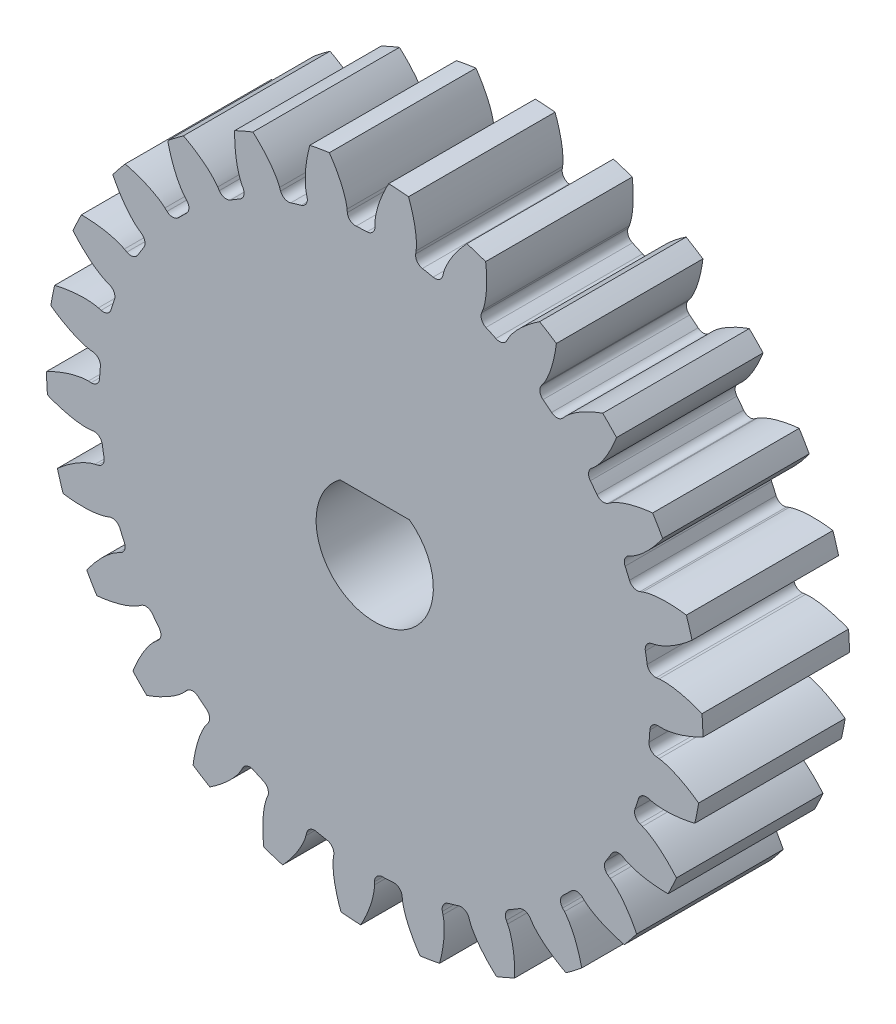
from build123d import *

# Parameters (mm, degrees)
SKETCH_1_R               = 11.2
EXTRUDE_1_DEPTH          = 5
CUT_EXTRUDE_1_DEPTH      = 17.609635758
FILLET_2_R               = 0.28
FILLET_2_OF_MIRROR_1_R   = 0.28
PATTERN_START            = -5
PATTERN_CIRCULAR_1_DEPTH = 5
SKETCH_2_R               = 2
CUT_EXTRUDE_2_DEPTH      = 17.601548526
EXTRUDE_3_DEPTH          = 5


# Read off the part's stored shape, not the designer's step: 円形ﾊﾟﾀｰﾝ1
with BuildPart() as part:
    # ｽｹｯﾁ1 → ﾎﾞｽ - 押し出し1 (new body)
    with BuildSketch(Plane.XY):
        Circle(SKETCH_1_R)
    extrude(amount=-EXTRUDE_1_DEPTH)

    # ｽｹｯﾁ1<3> → ｶｯﾄ - 押し出し1 (cut, symmetric)
    with BuildSketch(Plane.XY):
        with BuildLine():
            add(Edge.make_bspline(
                [(10.399190503, -0.129757001), (10.400093288, -0.129490448), (10.497765099, -0.100614056), (10.696224846, -0.033467992), (10.896342165, 0.049399549), (11.090355847, 0.143158919), (11.191994029, 0.195879842), (11.198229682, 0.199128068)],
                knots=[0.029784794, 0.029784794, 0.029784794, 0.029784794, 0.029784794, 0.029959921, 0.048733673, 0.068727069, 0.07003512, 0.07003512, 0.07003512, 0.07003512, 0.07003512], degree=4))
            ThreePointArc((10.399190503, -0.129757001), (10.390527177, -0.443784844), (10.372383211, -0.757407764))
            Line((10.372383211, -0.757407764), (11.170258843, -0.8156699))
            ThreePointArc((11.170258843, -0.8156699), (11.192562241, -0.408105967), (11.2, 0))
            ThreePointArc((11.2, 0), (11.199557412, 0.099567969), (11.198229682, 0.199128068))
        make_face()
        with BuildLine():
            add(Edge.make_bspline(
                [(9.769966437, -0.235455536), (9.800101919, -0.236405105), (9.884578506, -0.23506277), (10.044004201, -0.21657454), (10.200979816, -0.184369111), (10.326677086, -0.151167059), (10.399190503, -0.129757001)],
                knots=[0, 0, 0, 0, 0, 0.005604071, 0.015718253, 0.029784794, 0.029784794, 0.029784794, 0.029784794, 0.029784794], degree=4))
            Line((9.769966437, -0.235455536), (9.397271397, -0.22647361))
            ThreePointArc((9.397271397, -0.22647361), (9.388949447, -0.45566247), (9.375038672, -0.684580094))
            Line((9.375038672, -0.684580094), (10.372383211, -0.757407764))
            ThreePointArc((10.372383211, -0.757407764), (10.390527177, -0.443784844), (10.399190503, -0.129757001))
        make_face()
    cut_extrude_1 = extrude(amount=CUT_EXTRUDE_1_DEPTH, both=True, mode=Mode.SUBTRACT)

    # ﾌｨﾚｯﾄ2
    fillet_2_edges = [part.edges().sort_by_distance(p)[0] for p in [
        (9.397271397, -0.22647361, -2.5),
    ]]
    fillet(fillet_2_edges, radius=FILLET_2_R)

    # ﾐﾗｰ1: ｶｯﾄ - 押し出し1 across plane
    add(cut_extrude_1.mirror(Plane(origin=(0, 0, -5), x_dir=(0, 0, 1), z_dir=(-0.07282766960262782, -0.9973445395349847, 0))), mode=Mode.SUBTRACT)

    # ﾌｨﾚｯﾄ2 of ﾐﾗｰ1
    fillet_2_of_mirror_1_edges = [part.edges().sort_by_distance(p)[0] for p in [
        (9.33048709, -1.14105682, -2.5),
    ]]
    fillet(fillet_2_of_mirror_1_edges, radius=FILLET_2_OF_MIRROR_1_R)

    # 円形ﾊﾟﾀｰﾝ1 outline → 円形ﾊﾟﾀｰﾝ1 (cut)
    with BuildSketch(Plane.XY.offset(PATTERN_START)):
        with BuildLine():
            add(Edge.make_bspline(
                [(9.134750781, -3.473328612), (9.16301131, -3.483835347), (9.240719096, -3.516995499), (9.38216925, -3.59480306), (9.599992929, -3.740746118), (9.862226045, -3.957070023), (10.070011279, -4.162641677), (10.214219563, -4.322754447), (10.288404796, -4.409968936), (10.292950986, -4.415332376)],
                knots=[0, 0, 0, 0, 0, 0.005604071, 0.015718253, 0.029959921, 0.048733673, 0.068727069, 0.07003512, 0.07003512, 0.07003512, 0.07003512, 0.07003512], degree=4))
            ThreePointArc((10.292950986, -4.415332376), (10.650468838, -3.46518593), (10.920483945, -2.486570007))
            add(Edge.make_bspline(
                [(9.42972077, -2.566719634), (9.458753324, -2.574853503), (9.541096416, -2.593766744), (9.701250172, -2.614087598), (9.963248477, -2.624257141), (10.302567864, -2.6036515), (10.591536351, -2.559701276), (10.802350434, -2.515096896), (10.913652138, -2.488231556), (10.920483945, -2.486570007)],
                knots=[0, 0, 0, 0, 0, 0.005604071, 0.015718253, 0.029959921, 0.048733673, 0.068727069, 0.07003512, 0.07003512, 0.07003512, 0.07003512, 0.07003512], degree=4))
            Line((9.42972077, -2.566719634), (9.33626721, -2.541282074))
            ThreePointArc((9.33626721, -2.541282074), (9.127218802, -2.566427579), (8.994798123, -2.730129434))
            ThreePointArc((8.994798123, -2.730129434), (8.938786346, -2.908281049), (8.879246468, -3.085284777))
            ThreePointArc((8.879246468, -3.085284777), (8.889989852, -3.29556581), (9.044220531, -3.438906073))
            Line((9.044220531, -3.438906073), (9.134750781, -3.473328612))
        make_face()
        with BuildLine():
            add(Edge.make_bspline(
                [(8.038089581, -5.558488946), (8.063014485, -5.575453562), (8.130528479, -5.626246831), (8.249247781, -5.735644683), (8.425815439, -5.929475519), (8.628658839, -6.202269937), (8.781209695, -6.451594314), (8.882910054, -6.641565799), (8.934067806, -6.743999681), (8.937198337, -6.750295245)],
                knots=[0, 0, 0, 0, 0, 0.005604071, 0.015718253, 0.029959921, 0.048733673, 0.068727069, 0.07003512, 0.07003512, 0.07003512, 0.07003512, 0.07003512], degree=4))
            ThreePointArc((8.937198337, -6.750295245), (9.511712297, -5.913317949), (10.008079376, -5.027757671))
            add(Edge.make_bspline(
                [(8.541454008, -4.748815316), (8.567696366, -4.763660775), (8.643120483, -4.801730424), (8.793757364, -4.859788093), (9.045708743, -4.932362425), (9.380099378, -4.993559991), (9.671188943, -5.020041566), (9.886551678, -5.027184421), (10.001048454, -5.02773598), (10.008079376, -5.027757671)],
                knots=[0, 0, 0, 0, 0, 0.005604071, 0.015718253, 0.029959921, 0.048733673, 0.068727069, 0.07003512, 0.07003512, 0.07003512, 0.07003512, 0.07003512], degree=4))
            Line((8.541454008, -4.748815316), (8.456803646, -4.701752025))
            ThreePointArc((8.456803646, -4.701752025), (8.247812091, -4.676138289), (8.080062898, -4.803392922))
            ThreePointArc((8.080062898, -4.803392922), (7.98304425, -4.962963279), (7.882874727, -5.120574776))
            ThreePointArc((7.882874727, -5.120574776), (7.842982383, -5.327316484), (7.958427828, -5.503401357))
            Line((7.958427828, -5.503401357), (8.038089581, -5.558488946))
        make_face()
        with BuildLine():
            add(Edge.make_bspline(
                [(6.474283832, -7.320610107), (6.494424565, -7.343046682), (6.5478211, -7.408521147), (6.636910015, -7.543151485), (6.761960183, -7.773605356), (6.893625345, -8.087016467), (6.982076121, -8.36560374), (7.035358101, -8.574393488), (7.060515269, -8.686093679), (7.062048205, -8.69295549)],
                knots=[0, 0, 0, 0, 0, 0.005604071, 0.015718253, 0.029959921, 0.048733673, 0.068727069, 0.07003512, 0.07003512, 0.07003512, 0.07003512, 0.07003512], degree=4))
            ThreePointArc((7.062048205, -8.69295549), (7.820169612, -8.017789424), (8.514041612, -7.276750335))
            add(Edge.make_bspline(
                [(7.156788986, -6.654927114), (7.178716038, -6.675621398), (7.242837804, -6.730634984), (7.375203341, -6.823055368), (7.602465296, -6.953816734), (7.912493611, -7.093260927), (8.188787186, -7.188635288), (8.396182475, -7.247110261), (8.507220186, -7.275046664), (8.514041612, -7.276750335)],
                knots=[0, 0, 0, 0, 0, 0.005604071, 0.015718253, 0.029959921, 0.048733673, 0.068727069, 0.07003512, 0.07003512, 0.07003512, 0.07003512, 0.07003512], degree=4))
            Line((7.156788986, -6.654927114), (7.085861392, -6.588973238))
            ThreePointArc((7.085861392, -6.588973238), (6.88907252, -6.514088838), (6.695743787, -6.597500673))
            ThreePointArc((6.695743787, -6.597500673), (6.563356638, -6.729216124), (6.42837896, -6.858275581))
            ThreePointArc((6.42837896, -6.858275581), (6.340169285, -7.049462888), (6.410120228, -7.248058958))
            Line((6.410120228, -7.248058958), (6.474283832, -7.320610107))
        make_face()
        with BuildLine():
            add(Edge.make_bspline(
                [(4.53421624, -8.657284018), (4.548402295, -8.68388862), (4.58457816, -8.760239143), (4.638859163, -8.912277741), (4.70512438, -9.165961506), (4.757959403, -9.501774995), (4.777169663, -9.793434684), (4.778936707, -10.008908594), (4.776631248, -10.123383485), (4.776477501, -10.13041276)],
                knots=[0, 0, 0, 0, 0, 0.005604071, 0.015718253, 0.029959921, 0.048733673, 0.068727069, 0.07003512, 0.07003512, 0.07003512, 0.07003512, 0.07003512], degree=4))
            ThreePointArc((4.776477501, -10.13041276), (5.674147093, -9.65629612), (6.525198696, -9.102844719))
            add(Edge.make_bspline(
                [(5.356197402, -8.174278737), (5.372534827, -8.19961917), (5.421627718, -8.268379504), (5.528029308, -8.389791466), (5.7173942, -8.571140491), (5.985042477, -8.780727321), (6.230482884, -8.939451657), (6.417857666, -9.045860394), (6.518983203, -9.09955808), (6.525198696, -9.102844719)],
                knots=[0, 0, 0, 0, 0, 0.005604071, 0.015718253, 0.029959921, 0.048733673, 0.068727069, 0.07003512, 0.07003512, 0.07003512, 0.07003512, 0.07003512], degree=4))
            Line((5.356197402, -8.174278737), (5.303114631, -8.093267277))
            ThreePointArc((5.303114631, -8.093267277), (5.129965096, -7.973464222), (4.922292385, -8.008185667))
            ThreePointArc((4.922292385, -8.008185667), (4.762230596, -8.104391387), (4.600289175, -8.197398338))
            ThreePointArc((4.600289175, -8.197398338), (4.468888595, -8.361920133), (4.48927974, -8.571485718))
            Line((4.48927974, -8.571485718), (4.53421624, -8.657284018))
        make_face()
        with BuildLine():
            add(Edge.make_bspline(
                [(2.330636481, -9.49082805), (2.338043417, -9.520054516), (2.354896201, -9.602843882), (2.371214679, -9.76345481), (2.37484385, -10.025625289), (2.345778155, -10.364324897), (2.294631467, -10.652106802), (2.244780883, -10.861742313), (2.215146782, -10.972339039), (2.213315287, -10.979127262)],
                knots=[0, 0, 0, 0, 0, 0.005604071, 0.015718253, 0.029959921, 0.048733673, 0.068727069, 0.07003512, 0.07003512, 0.07003512, 0.07003512, 0.07003512], degree=4))
            ThreePointArc((2.213315287, -10.979127262), (3.19836377, -10.733613986), (4.15713495, -10.399914856))
            add(Edge.make_bspline(
                [(3.244323094, -9.218570992), (3.254121421, -9.24708488), (3.285332337, -9.325595862), (3.359586305, -9.46894338), (3.500048936, -9.690340716), (3.709762428, -9.957889759), (3.910085563, -10.170739589), (4.066550297, -10.318898002), (4.151886613, -10.395236256), (4.15713495, -10.399914856)],
                knots=[0, 0, 0, 0, 0, 0.005604071, 0.015718253, 0.029959921, 0.048733673, 0.068727069, 0.07003512, 0.07003512, 0.07003512, 0.07003512, 0.07003512], degree=4))
            Line((3.244323094, -9.218570992), (3.212170123, -9.127210039))
            ThreePointArc((3.212170123, -9.127210039), (3.072722747, -8.969450847), (2.862775242, -8.953464018))
            ThreePointArc((2.862775242, -8.953464018), (2.684341022, -9.008568881), (2.504847303, -9.0601181))
            ThreePointArc((2.504847303, -9.0601181), (2.337892343, -9.188412974), (2.307538631, -9.396768884))
            Line((2.307538631, -9.396768884), (2.330636481, -9.49082805))
        make_face()
        with BuildLine():
            add(Edge.make_bspline(
                [(-0.008391399, -9.772799654), (-0.008194046, -9.802949447), (-0.011643766, -9.88736624), (-0.034236184, -10.047215374), (-0.093453972, -10.302636173), (-0.202731193, -10.62453791), (-0.321262368, -10.891717192), (-0.419833447, -11.08333105), (-0.475073964, -11.183622132), (-0.478476767, -11.189774796)],
                knots=[0, 0, 0, 0, 0, 0.005604071, 0.015718253, 0.029959921, 0.048733673, 0.068727069, 0.07003512, 0.07003512, 0.07003512, 0.07003512, 0.07003512], degree=4))
            ThreePointArc((-0.478476767, -11.189774796), (0.536703171, -11.187133221), (1.547473631, -11.092579743))
            add(Edge.make_bspline(
                [(0.943900521, -9.72711341), (0.946590306, -9.757143629), (0.958105381, -9.840842486), (0.995896358, -9.997794723), (1.079293549, -10.246373563), (1.218884471, -10.55633584), (1.362448282, -10.810941105), (1.478909806, -10.992238765), (1.543497463, -11.086781086), (1.547473631, -11.092579743)],
                knots=[0, 0, 0, 0, 0, 0.005604071, 0.015718253, 0.029959921, 0.048733673, 0.068727069, 0.07003512, 0.07003512, 0.07003512, 0.07003512, 0.07003512], degree=4))
            Line((0.943900521, -9.72711341), (0.934545963, -9.63071253))
            ThreePointArc((0.934545963, -9.63071253), (0.83690492, -9.444165592), (0.636884007, -9.378399584))
            ThreePointArc((0.636884007, -9.378399584), (0.450447304, -9.389201096), (0.263832811, -9.396296731))
            ThreePointArc((0.263832811, -9.396296731), (0.071026286, -9.480908651), (-0.008308236, -9.675945999))
            Line((-0.008308236, -9.675945999), (-0.008391399, -9.772799654))
        make_face()
        with BuildLine():
            add(Edge.make_bspline(
                [(-2.346931601, -9.486811664), (-2.353955301, -9.516132589), (-2.377507039, -9.597270811), (-2.437697364, -9.7470683), (-2.556320589, -9.98089529), (-2.73945854, -10.267291397), (-2.918485603, -10.498340568), (-3.060048583, -10.660796873), (-3.137685138, -10.744953757), (-3.14246149, -10.750113292)],
                knots=[0, 0, 0, 0, 0, 0.005604071, 0.015718253, 0.029959921, 0.048733673, 0.068727069, 0.07003512, 0.07003512, 0.07003512, 0.07003512, 0.07003512], degree=4))
            ThreePointArc((-3.14246149, -10.750113292), (-2.156148666, -10.990496938), (-1.15212123, -11.140584216))
            add(Edge.make_bspline(
                [(-1.41137812, -9.670351353), (-1.415953197, -9.700152656), (-1.424803176, -9.784175114), (-1.425671466, -9.945610577), (-1.404186456, -10.206924422), (-1.34283062, -10.541286053), (-1.264369541, -10.82285002), (-1.194679547, -11.026750567), (-1.154594148, -11.134002497), (-1.15212123, -11.140584216)],
                knots=[0, 0, 0, 0, 0, 0.005604071, 0.015718253, 0.029959921, 0.048733673, 0.068727069, 0.07003512, 0.07003512, 0.07003512, 0.07003512, 0.07003512], degree=4))
            Line((-1.41137812, -9.670351353), (-1.397390611, -9.574513015))
            ThreePointArc((-1.397390611, -9.574513015), (-1.447550778, -9.370019761), (-1.626020611, -9.258296656))
            ThreePointArc((-1.626020611, -9.258296656), (-1.809624774, -9.224167072), (-1.992514685, -9.186396749))
            ThreePointArc((-1.992514685, -9.186396749), (-2.199967561, -9.222408379), (-2.323672258, -9.392792302))
            Line((-2.323672258, -9.392792302), (-2.346931601, -9.486811664))
        make_face()
        with BuildLine():
            add(Edge.make_bspline(
                [(-4.54907667, -8.649484663), (-4.56291323, -8.676272694), (-4.605198245, -8.749416887), (-4.699488434, -8.880457046), (-4.870623145, -9.079101053), (-5.116978515, -9.313347229), (-5.346097062, -9.49483855), (-5.522424818, -9.618695931), (-5.617945456, -9.681827726), (-5.623817774, -9.685694278)],
                knots=[0, 0, 0, 0, 0, 0.005604071, 0.015718253, 0.029959921, 0.048733673, 0.068727069, 0.07003512, 0.07003512, 0.07003512, 0.07003512, 0.07003512], degree=4))
            ThreePointArc((-5.623817774, -9.685694278), (-4.72369298, -10.155132921), (-3.784758993, -10.541138428))
            add(Edge.make_bspline(
                [(-3.684632595, -9.051583625), (-3.696206647, -9.079424069), (-3.724907352, -9.158887048), (-3.764384446, -9.315423695), (-3.806060248, -9.574285934), (-3.826505277, -9.913615037), (-3.817706802, -10.205774231), (-3.798838468, -10.420427706), (-3.785584944, -10.534156154), (-3.784758993, -10.541138428)],
                knots=[0, 0, 0, 0, 0, 0.005604071, 0.015718253, 0.029959921, 0.048733673, 0.068727069, 0.07003512, 0.07003512, 0.07003512, 0.07003512, 0.07003512], degree=4))
            Line((-3.684632595, -9.051583625), (-3.648115922, -8.961877606))
            ThreePointArc((-3.648115922, -8.961877606), (-3.647880087, -8.75132244), (-3.794426821, -8.600135179))
            ThreePointArc((-3.794426821, -8.600135179), (-3.964528037, -8.523057987), (-4.13306447, -8.44261678))
            ThreePointArc((-4.13306447, -8.44261678), (-4.34310729, -8.427935255), (-4.503992895, -8.563763659))
            Line((-4.503992895, -8.563763659), (-4.54907667, -8.649484663))
        make_face()
        with BuildLine():
            add(Edge.make_bspline(
                [(-6.486845937, -7.309481054), (-6.506691227, -7.332179367), (-6.565252068, -7.393078657), (-6.688162318, -7.497745907), (-6.901862788, -7.649662464), (-7.197118298, -7.818145172), (-7.463012792, -7.939531028), (-7.663857796, -8.017591345), (-7.771711205, -8.056029059), (-7.77833821, -8.058377919)],
                knots=[0, 0, 0, 0, 0, 0.005604071, 0.015718253, 0.029959921, 0.048733673, 0.068727069, 0.07003512, 0.07003512, 0.07003512, 0.07003512, 0.07003512], degree=4))
            ThreePointArc((-7.77833821, -8.058377919), (-7.016713428, -8.729589491), (-6.197440321, -9.329079991))
            add(Edge.make_bspline(
                [(-5.743749616, -7.906770758), (-5.761650002, -7.931032358), (-5.808533453, -8.001317759), (-5.884325086, -8.143858248), (-5.986739652, -8.385224749), (-6.087797356, -8.709800749), (-6.149172821, -8.995575941), (-6.182222705, -9.208507464), (-6.196571304, -9.322102946), (-6.197440321, -9.329079991)],
                knots=[0, 0, 0, 0, 0, 0.005604071, 0.015718253, 0.029959921, 0.048733673, 0.068727069, 0.07003512, 0.07003512, 0.07003512, 0.07003512, 0.07003512], degree=4))
            Line((-5.743749616, -7.906770758), (-5.686825996, -7.828410445))
            ThreePointArc((-5.686825996, -7.828410445), (-5.636207865, -7.624030069), (-5.742314737, -7.442165105))
            ThreePointArc((-5.742314737, -7.442165105), (-5.889027341, -7.326619751), (-6.033415571, -7.208182611))
            ThreePointArc((-6.033415571, -7.208182611), (-6.233841409, -7.143661167), (-6.422557836, -7.237040199))
            Line((-6.422557836, -7.237040199), (-6.486845937, -7.309481054))
        make_face()
        with BuildLine():
            add(Edge.make_bspline(
                [(-8.047623297, -5.544676974), (-8.072323982, -5.561966427), (-8.143757305, -5.607081568), (-8.288144519, -5.67929303), (-8.531991253, -5.775653297), (-8.858987726, -5.868580936), (-9.146205346, -5.922806822), (-9.359895215, -5.950533493), (-9.473813348, -5.962043266), (-9.480809903, -5.962737926)],
                knots=[0, 0, 0, 0, 0, 0.005604071, 0.015718253, 0.029959921, 0.048733673, 0.068727069, 0.07003512, 0.07003512, 0.07003512, 0.07003512, 0.07003512], degree=4))
            ThreePointArc((-9.480809903, -5.962737926), (-8.901947996, -6.79671405), (-8.249948944, -7.574849334))
            add(Edge.make_bspline(
                [(-7.469060788, -6.302445115), (-7.492247201, -6.321717874), (-7.554588702, -6.378740965), (-7.662290139, -6.499001362), (-7.81949151, -6.70884478), (-7.995288781, -6.9998045), (-8.123271266, -7.262587475), (-8.20631863, -7.46142224), (-8.247435462, -7.568282999), (-8.249948944, -7.574849334)],
                knots=[0, 0, 0, 0, 0, 0.005604071, 0.015718253, 0.029959921, 0.048733673, 0.068727069, 0.07003512, 0.07003512, 0.07003512, 0.07003512, 0.07003512], degree=4))
            Line((-7.469060788, -6.302445115), (-7.395038414, -6.239984524))
            ThreePointArc((-7.395038414, -6.239984524), (-7.296979728, -6.053656782), (-7.356480193, -5.851683447))
            ThreePointArc((-7.356480193, -5.851683447), (-7.471277782, -5.704385006), (-7.583126489, -5.554835069))
            ThreePointArc((-7.583126489, -5.554835069), (-7.762287325, -5.444223459), (-7.96786706, -5.489726269))
            Line((-7.96786706, -5.489726269), (-8.047623297, -5.544676974))
        make_face()
        with BuildLine():
            add(Edge.make_bspline(
                [(-9.140702044, -3.457636423), (-9.168822608, -3.468512215), (-9.248976968, -3.495221279), (-9.406449886, -3.530780285), (-9.666271399, -3.565984155), (-10.006004988, -3.577956107), (-10.297853691, -3.561870612), (-10.511969547, -3.537652263), (-10.625331895, -3.52156519), (-10.632291386, -3.520565279)],
                knots=[0, 0, 0, 0, 0, 0.005604071, 0.015718253, 0.029959921, 0.048733673, 0.068727069, 0.07003512, 0.07003512, 0.07003512, 0.07003512, 0.07003512], degree=4))
            ThreePointArc((-10.632291386, -3.520565279), (-10.269833704, -4.468838295), (-9.823000521, -5.380395967))
            add(Edge.make_bspline(
                [(-8.760297295, -4.33184427), (-8.787422227, -4.345008126), (-8.861598715, -4.385454932), (-8.994950742, -4.476446139), (-9.197802943, -4.642571139), (-9.438123084, -4.883005057), (-9.625274713, -5.107523823), (-9.753493144, -5.280706276), (-9.81898865, -5.374621953), (-9.823000521, -5.380395967)],
                knots=[0, 0, 0, 0, 0, 0.005604071, 0.015718253, 0.029959921, 0.048733673, 0.068727069, 0.07003512, 0.07003512, 0.07003512, 0.07003512, 0.07003512], degree=4))
            Line((-8.760297295, -4.33184427), (-8.673478079, -4.288913384))
            ThreePointArc((-8.673478079, -4.288913384), (-8.533677653, -4.131466967), (-8.54311376, -3.921123217))
            ThreePointArc((-8.54311376, -3.921123217), (-8.619324715, -3.75063214), (-8.69213366, -3.578660705))
            ThreePointArc((-8.69213366, -3.578660705), (-8.839617316, -3.428387272), (-9.050112813, -3.423369402))
            Line((-9.050112813, -3.423369402), (-9.140702044, -3.457636423))
        make_face()
        with BuildLine():
            add(Edge.make_bspline(
                [(-9.702556412, -1.169650611), (-9.732462591, -1.173480681), (-9.816679709, -1.180231433), (-9.978086577, -1.177071424), (-10.238782987, -1.149072975), (-10.571509611, -1.079393475), (-10.85102821, -0.993931429), (-11.053126418, -0.919175543), (-11.159344773, -0.876426545), (-11.16586274, -0.873790174)],
                knots=[0, 0, 0, 0, 0, 0.005604071, 0.015718253, 0.029959921, 0.048733673, 0.068727069, 0.07003512, 0.07003512, 0.07003512, 0.07003512, 0.07003512], degree=4))
            ThreePointArc((-11.16586274, -0.873790174), (-11.040874006, -1.881249901), (-10.825175014, -2.873253544))
            add(Edge.make_bspline(
                [(-9.542417166, -2.109492382), (-9.571904213, -2.115782299), (-9.653604822, -2.137302198), (-9.804857502, -2.193736138), (-10.041571502, -2.306488138), (-10.332447979, -2.482423109), (-10.567892179, -2.655629451), (-10.73383009, -2.793094858), (-10.819897909, -2.868607416), (-10.825175014, -2.873253544)],
                knots=[0, 0, 0, 0, 0, 0.005604071, 0.015718253, 0.029959921, 0.048733673, 0.068727069, 0.07003512, 0.07003512, 0.07003512, 0.07003512, 0.07003512], degree=4))
            Line((-9.542417166, -2.109492382), (-9.447846725, -2.088586188))
            ThreePointArc((-9.447846725, -2.088586188), (-9.274429251, -1.969171309), (-9.233252608, -1.762681558))
            ThreePointArc((-9.233252608, -1.762681558), (-9.266447826, -1.578906167), (-9.295985617, -1.394507588))
            ThreePointArc((-9.295985617, -1.394507588), (-9.40322088, -1.213305679), (-9.606398906, -1.15805875))
            Line((-9.606398906, -1.15805875), (-9.702556412, -1.169650611))
        make_face()
        with BuildLine():
            add(Edge.make_bspline(
                [(-9.700533469, 1.186311043), (-9.730487225, 1.189749285), (-9.813872707, 1.203349173), (-9.969833145, 1.24504455), (-10.216253724, 1.334618149), (-10.522636521, 1.481899583), (-10.773580411, 1.631771436), (-10.951915758, 1.752720319), (-11.044817096, 1.819646825), (-11.050514738, 1.823766439)],
                knots=[0, 0, 0, 0, 0, 0.005604071, 0.015718253, 0.029959921, 0.048733673, 0.068727069, 0.07003512, 0.07003512, 0.07003512, 0.07003512, 0.07003512], degree=4))
            ThreePointArc((-11.050514738, 1.823766439), (-11.170258843, 0.8156699), (-11.198229682, -0.199128068))
            add(Edge.make_bspline(
                [(-9.769966437, 0.235455536), (-9.800101919, 0.236405105), (-9.884578506, 0.23506277), (-10.044941584, 0.216465834), (-10.301760425, 0.16363957), (-10.626288554, 0.062428247), (-10.896342165, -0.049399549), (-11.090355847, -0.143158919), (-11.191994029, -0.195879842), (-11.198229682, -0.199128068)],
                knots=[0, 0, 0, 0, 0, 0.005604071, 0.015718253, 0.029959921, 0.048733673, 0.068727069, 0.07003512, 0.07003512, 0.07003512, 0.07003512, 0.07003512], degree=4))
            Line((-9.769966437, 0.235455536), (-9.673140861, 0.233122046))
            ThreePointArc((-9.673140861, 0.233122046), (-9.476184733, 0.307565427), (-9.386788376, 0.498200746))
            ThreePointArc((-9.386788376, 0.498200746), (-9.375038672, 0.684580094), (-9.359588679, 0.870689242))
            ThreePointArc((-9.359588679, 0.870689242), (-9.420343425, 1.07228883), (-9.604396011, 1.174554069))
            Line((-9.604396011, 1.174554069), (-9.700533469, 1.186311043))
        make_face()
        with BuildLine():
            add(Edge.make_bspline(
                [(-9.134750781, 3.473328612), (-9.16301131, 3.483835347), (-9.240719096, 3.516995499), (-9.38216925, 3.59480306), (-9.599992929, 3.740746118), (-9.862226045, 3.957070023), (-10.070011279, 4.162641677), (-10.214219563, 4.322754447), (-10.288404796, 4.409968936), (-10.292950986, 4.415332376)],
                knots=[0, 0, 0, 0, 0, 0.005604071, 0.015718253, 0.029959921, 0.048733673, 0.068727069, 0.07003512, 0.07003512, 0.07003512, 0.07003512, 0.07003512], degree=4))
            ThreePointArc((-10.292950986, 4.415332376), (-10.650468838, 3.46518593), (-10.920483946, 2.486570007))
            add(Edge.make_bspline(
                [(-9.42972077, 2.566719634), (-9.458753324, 2.574853503), (-9.541096416, 2.593766744), (-9.701250172, 2.614087598), (-9.963248477, 2.624257141), (-10.302567864, 2.6036515), (-10.591536351, 2.559701276), (-10.802350434, 2.515096896), (-10.913652138, 2.488231556), (-10.920483946, 2.486570007)],
                knots=[0, 0, 0, 0, 0, 0.005604071, 0.015718253, 0.029959921, 0.048733673, 0.068727069, 0.07003512, 0.07003512, 0.07003512, 0.07003512, 0.07003512], degree=4))
            Line((-9.42972077, 2.566719634), (-9.33626721, 2.541282074))
            ThreePointArc((-9.33626721, 2.541282074), (-9.127218802, 2.566427579), (-8.994798123, 2.730129434))
            ThreePointArc((-8.994798123, 2.730129434), (-8.938786346, 2.908281049), (-8.879246468, 3.085284777))
            ThreePointArc((-8.879246468, 3.085284777), (-8.889989852, 3.29556581), (-9.044220531, 3.438906073))
            Line((-9.044220531, 3.438906073), (-9.134750781, 3.473328612))
        make_face()
        with BuildLine():
            add(Edge.make_bspline(
                [(-8.038089581, 5.558488946), (-8.063014485, 5.575453562), (-8.130528479, 5.626246831), (-8.249247781, 5.735644683), (-8.425815439, 5.929475519), (-8.628658839, 6.202269937), (-8.781209695, 6.451594314), (-8.882910054, 6.641565799), (-8.934067806, 6.743999681), (-8.937198337, 6.750295245)],
                knots=[0, 0, 0, 0, 0, 0.005604071, 0.015718253, 0.029959921, 0.048733673, 0.068727069, 0.07003512, 0.07003512, 0.07003512, 0.07003512, 0.07003512], degree=4))
            ThreePointArc((-8.937198337, 6.750295245), (-9.511712298, 5.91331795), (-10.008079376, 5.027757671))
            add(Edge.make_bspline(
                [(-8.541454008, 4.748815316), (-8.567696366, 4.763660775), (-8.643120483, 4.801730424), (-8.793757364, 4.859788093), (-9.045708743, 4.932362425), (-9.380099378, 4.993559991), (-9.671188943, 5.020041566), (-9.886551678, 5.027184421), (-10.001048454, 5.02773598), (-10.008079376, 5.027757671)],
                knots=[0, 0, 0, 0, 0, 0.005604071, 0.015718253, 0.029959921, 0.048733673, 0.068727069, 0.07003512, 0.07003512, 0.07003512, 0.07003512, 0.07003512], degree=4))
            Line((-8.541454008, 4.748815316), (-8.456803646, 4.701752025))
            ThreePointArc((-8.456803646, 4.701752025), (-8.247812091, 4.676138289), (-8.080062898, 4.803392922))
            ThreePointArc((-8.080062898, 4.803392922), (-7.98304425, 4.962963279), (-7.882874727, 5.120574776))
            ThreePointArc((-7.882874727, 5.120574776), (-7.842982383, 5.327316484), (-7.958427828, 5.503401357))
            Line((-7.958427828, 5.503401357), (-8.038089581, 5.558488946))
        make_face()
        with BuildLine():
            add(Edge.make_bspline(
                [(-6.474283832, 7.320610107), (-6.494424565, 7.343046682), (-6.5478211, 7.408521147), (-6.636910015, 7.543151485), (-6.761960183, 7.773605356), (-6.893625345, 8.087016467), (-6.982076121, 8.36560374), (-7.035358101, 8.574393488), (-7.060515269, 8.686093679), (-7.062048205, 8.69295549)],
                knots=[0, 0, 0, 0, 0, 0.005604071, 0.015718253, 0.029959921, 0.048733673, 0.068727069, 0.07003512, 0.07003512, 0.07003512, 0.07003512, 0.07003512], degree=4))
            ThreePointArc((-7.062048205, 8.69295549), (-7.820169612, 8.017789424), (-8.514041612, 7.276750335))
            add(Edge.make_bspline(
                [(-7.156788986, 6.654927114), (-7.178716038, 6.675621398), (-7.242837804, 6.730634984), (-7.375203341, 6.823055368), (-7.602465296, 6.953816734), (-7.912493611, 7.093260927), (-8.188787186, 7.188635288), (-8.396182475, 7.247110261), (-8.507220186, 7.275046664), (-8.514041612, 7.276750335)],
                knots=[0, 0, 0, 0, 0, 0.005604071, 0.015718253, 0.029959921, 0.048733673, 0.068727069, 0.07003512, 0.07003512, 0.07003512, 0.07003512, 0.07003512], degree=4))
            Line((-7.156788986, 6.654927114), (-7.085861392, 6.588973238))
            ThreePointArc((-7.085861392, 6.588973238), (-6.88907252, 6.514088838), (-6.695743787, 6.597500673))
            ThreePointArc((-6.695743787, 6.597500673), (-6.563356638, 6.729216124), (-6.42837896, 6.858275581))
            ThreePointArc((-6.42837896, 6.858275581), (-6.340169285, 7.049462888), (-6.410120228, 7.248058958))
            Line((-6.410120228, 7.248058958), (-6.474283832, 7.320610107))
        make_face()
        with BuildLine():
            add(Edge.make_bspline(
                [(-4.53421624, 8.657284018), (-4.548402295, 8.68388862), (-4.58457816, 8.760239143), (-4.638859163, 8.912277741), (-4.70512438, 9.165961506), (-4.757959403, 9.501774995), (-4.777169663, 9.793434684), (-4.778936707, 10.008908594), (-4.776631248, 10.123383485), (-4.776477501, 10.13041276)],
                knots=[0, 0, 0, 0, 0, 0.005604071, 0.015718253, 0.029959921, 0.048733673, 0.068727069, 0.07003512, 0.07003512, 0.07003512, 0.07003512, 0.07003512], degree=4))
            ThreePointArc((-4.776477501, 10.13041276), (-5.674147093, 9.65629612), (-6.525198696, 9.102844719))
            add(Edge.make_bspline(
                [(-5.356197402, 8.174278737), (-5.372534827, 8.19961917), (-5.421627718, 8.268379504), (-5.528029308, 8.389791466), (-5.7173942, 8.571140491), (-5.985042477, 8.780727321), (-6.230482884, 8.939451657), (-6.417857666, 9.045860394), (-6.518983203, 9.09955808), (-6.525198696, 9.102844719)],
                knots=[0, 0, 0, 0, 0, 0.005604071, 0.015718253, 0.029959921, 0.048733673, 0.068727069, 0.07003512, 0.07003512, 0.07003512, 0.07003512, 0.07003512], degree=4))
            Line((-5.356197402, 8.174278737), (-5.303114631, 8.093267277))
            ThreePointArc((-5.303114631, 8.093267277), (-5.129965096, 7.973464222), (-4.922292385, 8.008185667))
            ThreePointArc((-4.922292385, 8.008185667), (-4.762230596, 8.104391387), (-4.600289175, 8.197398338))
            ThreePointArc((-4.600289175, 8.197398338), (-4.468888595, 8.361920133), (-4.48927974, 8.571485718))
            Line((-4.48927974, 8.571485718), (-4.53421624, 8.657284018))
        make_face()
        with BuildLine():
            add(Edge.make_bspline(
                [(-2.330636481, 9.49082805), (-2.338043417, 9.520054516), (-2.354896201, 9.602843882), (-2.371214679, 9.76345481), (-2.37484385, 10.025625289), (-2.345778155, 10.364324897), (-2.294631467, 10.652106802), (-2.244780883, 10.861742313), (-2.215146782, 10.972339039), (-2.213315287, 10.979127262)],
                knots=[0, 0, 0, 0, 0, 0.005604071, 0.015718253, 0.029959921, 0.048733673, 0.068727069, 0.07003512, 0.07003512, 0.07003512, 0.07003512, 0.07003512], degree=4))
            ThreePointArc((-2.213315287, 10.979127262), (-3.19836377, 10.733613986), (-4.15713495, 10.399914856))
            add(Edge.make_bspline(
                [(-3.244323094, 9.218570992), (-3.254121421, 9.24708488), (-3.285332337, 9.325595862), (-3.359586305, 9.46894338), (-3.500048936, 9.690340716), (-3.709762428, 9.957889759), (-3.910085563, 10.170739589), (-4.066550297, 10.318898002), (-4.151886613, 10.395236256), (-4.15713495, 10.399914856)],
                knots=[0, 0, 0, 0, 0, 0.005604071, 0.015718253, 0.029959921, 0.048733673, 0.068727069, 0.07003512, 0.07003512, 0.07003512, 0.07003512, 0.07003512], degree=4))
            Line((-3.244323094, 9.218570992), (-3.212170123, 9.127210039))
            ThreePointArc((-3.212170123, 9.127210039), (-3.072722747, 8.969450847), (-2.862775242, 8.953464018))
            ThreePointArc((-2.862775242, 8.953464018), (-2.684341022, 9.008568881), (-2.504847303, 9.0601181))
            ThreePointArc((-2.504847303, 9.0601181), (-2.337892343, 9.188412974), (-2.307538631, 9.396768884))
            Line((-2.307538631, 9.396768884), (-2.330636481, 9.49082805))
        make_face()
        with BuildLine():
            add(Edge.make_bspline(
                [(0.008391399, 9.772799654), (0.008194046, 9.802949447), (0.011643766, 9.88736624), (0.034236184, 10.047215374), (0.093453972, 10.302636173), (0.202731193, 10.62453791), (0.321262368, 10.891717192), (0.419833447, 11.08333105), (0.475073964, 11.183622132), (0.478476767, 11.189774796)],
                knots=[0, 0, 0, 0, 0, 0.005604071, 0.015718253, 0.029959921, 0.048733673, 0.068727069, 0.07003512, 0.07003512, 0.07003512, 0.07003512, 0.07003512], degree=4))
            ThreePointArc((0.478476767, 11.189774796), (-0.536703171, 11.187133221), (-1.547473631, 11.092579743))
            add(Edge.make_bspline(
                [(-0.943900521, 9.72711341), (-0.946590306, 9.757143629), (-0.958105381, 9.840842486), (-0.995896358, 9.997794723), (-1.079293549, 10.246373563), (-1.218884471, 10.55633584), (-1.362448282, 10.810941105), (-1.478909806, 10.992238765), (-1.543497463, 11.086781086), (-1.547473631, 11.092579743)],
                knots=[0, 0, 0, 0, 0, 0.005604071, 0.015718253, 0.029959921, 0.048733673, 0.068727069, 0.07003512, 0.07003512, 0.07003512, 0.07003512, 0.07003512], degree=4))
            Line((-0.943900521, 9.72711341), (-0.934545963, 9.63071253))
            ThreePointArc((-0.934545963, 9.63071253), (-0.83690492, 9.444165592), (-0.636884007, 9.378399584))
            ThreePointArc((-0.636884007, 9.378399584), (-0.450447304, 9.389201096), (-0.263832811, 9.396296731))
            ThreePointArc((-0.263832811, 9.396296731), (-0.071026286, 9.480908651), (0.008308236, 9.675945999))
            Line((0.008308236, 9.675945999), (0.008391399, 9.772799654))
        make_face()
        with BuildLine():
            add(Edge.make_bspline(
                [(2.346931601, 9.486811664), (2.353955301, 9.516132589), (2.377507039, 9.597270811), (2.437697364, 9.7470683), (2.556320589, 9.98089529), (2.73945854, 10.267291397), (2.918485603, 10.498340568), (3.060048583, 10.660796873), (3.137685138, 10.744953757), (3.14246149, 10.750113292)],
                knots=[0, 0, 0, 0, 0, 0.005604071, 0.015718253, 0.029959921, 0.048733673, 0.068727069, 0.07003512, 0.07003512, 0.07003512, 0.07003512, 0.07003512], degree=4))
            ThreePointArc((3.14246149, 10.750113292), (2.156148666, 10.990496937), (1.15212123, 11.140584216))
            add(Edge.make_bspline(
                [(1.41137812, 9.670351353), (1.415953197, 9.700152656), (1.424803176, 9.784175114), (1.425671466, 9.945610577), (1.404186456, 10.206924422), (1.34283062, 10.541286053), (1.264369541, 10.82285002), (1.194679547, 11.026750567), (1.154594148, 11.134002497), (1.15212123, 11.140584216)],
                knots=[0, 0, 0, 0, 0, 0.005604071, 0.015718253, 0.029959921, 0.048733673, 0.068727069, 0.07003512, 0.07003512, 0.07003512, 0.07003512, 0.07003512], degree=4))
            Line((1.41137812, 9.670351353), (1.397390611, 9.574513015))
            ThreePointArc((1.397390611, 9.574513015), (1.447550778, 9.370019761), (1.626020611, 9.258296656))
            ThreePointArc((1.626020611, 9.258296656), (1.809624774, 9.224167072), (1.992514685, 9.186396749))
            ThreePointArc((1.992514685, 9.186396749), (2.199967561, 9.222408379), (2.323672258, 9.392792302))
            Line((2.323672258, 9.392792302), (2.346931601, 9.486811664))
        make_face()
        with BuildLine():
            add(Edge.make_bspline(
                [(4.54907667, 8.649484663), (4.56291323, 8.676272694), (4.605198245, 8.749416887), (4.699488434, 8.880457046), (4.870623145, 9.079101053), (5.116978515, 9.313347229), (5.346097062, 9.49483855), (5.522424818, 9.618695931), (5.617945456, 9.681827726), (5.623817774, 9.685694278)],
                knots=[0, 0, 0, 0, 0, 0.005604071, 0.015718253, 0.029959921, 0.048733673, 0.068727069, 0.07003512, 0.07003512, 0.07003512, 0.07003512, 0.07003512], degree=4))
            ThreePointArc((5.623817774, 9.685694278), (4.72369298, 10.15513292), (3.784758993, 10.541138428))
            add(Edge.make_bspline(
                [(3.684632595, 9.051583625), (3.696206647, 9.079424069), (3.724907352, 9.158887048), (3.764384446, 9.315423695), (3.806060248, 9.574285934), (3.826505277, 9.913615037), (3.817706802, 10.205774231), (3.798838468, 10.420427706), (3.785584944, 10.534156154), (3.784758993, 10.541138428)],
                knots=[0, 0, 0, 0, 0, 0.005604071, 0.015718253, 0.029959921, 0.048733673, 0.068727069, 0.07003512, 0.07003512, 0.07003512, 0.07003512, 0.07003512], degree=4))
            Line((3.684632595, 9.051583625), (3.648115922, 8.961877606))
            ThreePointArc((3.648115922, 8.961877606), (3.647880087, 8.75132244), (3.794426821, 8.600135179))
            ThreePointArc((3.794426821, 8.600135179), (3.964528037, 8.523057987), (4.13306447, 8.44261678))
            ThreePointArc((4.13306447, 8.44261678), (4.34310729, 8.427935255), (4.503992895, 8.563763659))
            Line((4.503992895, 8.563763659), (4.54907667, 8.649484663))
        make_face()
        with BuildLine():
            add(Edge.make_bspline(
                [(6.486845937, 7.309481054), (6.506691227, 7.332179367), (6.565252068, 7.393078657), (6.688162318, 7.497745907), (6.901862788, 7.649662464), (7.197118298, 7.818145172), (7.463012792, 7.939531028), (7.663857796, 8.017591345), (7.771711205, 8.056029059), (7.77833821, 8.058377919)],
                knots=[0, 0, 0, 0, 0, 0.005604071, 0.015718253, 0.029959921, 0.048733673, 0.068727069, 0.07003512, 0.07003512, 0.07003512, 0.07003512, 0.07003512], degree=4))
            ThreePointArc((7.77833821, 8.058377919), (7.016713428, 8.72958949), (6.197440321, 9.329079991))
            add(Edge.make_bspline(
                [(5.743749616, 7.906770758), (5.761650002, 7.931032358), (5.808533453, 8.001317759), (5.884325086, 8.143858248), (5.986739652, 8.385224749), (6.087797356, 8.709800749), (6.149172821, 8.995575941), (6.182222705, 9.208507464), (6.196571304, 9.322102946), (6.197440321, 9.329079991)],
                knots=[0, 0, 0, 0, 0, 0.005604071, 0.015718253, 0.029959921, 0.048733673, 0.068727069, 0.07003512, 0.07003512, 0.07003512, 0.07003512, 0.07003512], degree=4))
            Line((5.743749616, 7.906770758), (5.686825996, 7.828410445))
            ThreePointArc((5.686825996, 7.828410445), (5.636207865, 7.624030069), (5.742314737, 7.442165105))
            ThreePointArc((5.742314737, 7.442165105), (5.889027341, 7.326619751), (6.033415571, 7.208182611))
            ThreePointArc((6.033415571, 7.208182611), (6.233841409, 7.143661167), (6.422557836, 7.237040199))
            Line((6.422557836, 7.237040199), (6.486845937, 7.309481054))
        make_face()
        with BuildLine():
            add(Edge.make_bspline(
                [(8.047623297, 5.544676974), (8.072323982, 5.561966427), (8.143757305, 5.607081568), (8.288144519, 5.67929303), (8.531991253, 5.775653297), (8.858987726, 5.868580936), (9.146205346, 5.922806822), (9.359895215, 5.950533493), (9.473813348, 5.962043266), (9.480809903, 5.962737926)],
                knots=[0, 0, 0, 0, 0, 0.005604071, 0.015718253, 0.029959921, 0.048733673, 0.068727069, 0.07003512, 0.07003512, 0.07003512, 0.07003512, 0.07003512], degree=4))
            ThreePointArc((9.480809903, 5.962737926), (8.901947996, 6.79671405), (8.249948943, 7.574849334))
            add(Edge.make_bspline(
                [(7.469060788, 6.302445115), (7.492247201, 6.321717874), (7.554588702, 6.378740965), (7.662290139, 6.499001362), (7.81949151, 6.70884478), (7.995288781, 6.9998045), (8.123271266, 7.262587475), (8.20631863, 7.46142224), (8.247435462, 7.568282999), (8.249948943, 7.574849334)],
                knots=[0, 0, 0, 0, 0, 0.005604071, 0.015718253, 0.029959921, 0.048733673, 0.068727069, 0.07003512, 0.07003512, 0.07003512, 0.07003512, 0.07003512], degree=4))
            Line((7.469060788, 6.302445115), (7.395038414, 6.239984524))
            ThreePointArc((7.395038414, 6.239984524), (7.296979728, 6.053656782), (7.356480193, 5.851683447))
            ThreePointArc((7.356480193, 5.851683447), (7.471277782, 5.704385006), (7.583126489, 5.554835069))
            ThreePointArc((7.583126489, 5.554835069), (7.762287325, 5.444223459), (7.96786706, 5.489726269))
            Line((7.96786706, 5.489726269), (8.047623297, 5.544676974))
        make_face()
        with BuildLine():
            add(Edge.make_bspline(
                [(9.140702044, 3.457636423), (9.168822608, 3.468512215), (9.248976968, 3.495221279), (9.406449886, 3.530780285), (9.666271399, 3.565984155), (10.006004988, 3.577956107), (10.297853691, 3.561870612), (10.511969547, 3.537652263), (10.625331895, 3.52156519), (10.632291386, 3.520565279)],
                knots=[0, 0, 0, 0, 0, 0.005604071, 0.015718253, 0.029959921, 0.048733673, 0.068727069, 0.07003512, 0.07003512, 0.07003512, 0.07003512, 0.07003512], degree=4))
            ThreePointArc((10.632291386, 3.520565279), (10.269833703, 4.468838294), (9.823000521, 5.380395967))
            add(Edge.make_bspline(
                [(8.760297295, 4.33184427), (8.787422227, 4.345008126), (8.861598715, 4.385454932), (8.994950742, 4.476446139), (9.197802943, 4.642571139), (9.438123084, 4.883005057), (9.625274713, 5.107523823), (9.753493144, 5.280706276), (9.81898865, 5.374621953), (9.823000521, 5.380395967)],
                knots=[0, 0, 0, 0, 0, 0.005604071, 0.015718253, 0.029959921, 0.048733673, 0.068727069, 0.07003512, 0.07003512, 0.07003512, 0.07003512, 0.07003512], degree=4))
            Line((8.760297295, 4.33184427), (8.673478079, 4.288913384))
            ThreePointArc((8.673478079, 4.288913384), (8.533677653, 4.131466967), (8.54311376, 3.921123217))
            ThreePointArc((8.54311376, 3.921123217), (8.619324715, 3.75063214), (8.69213366, 3.578660705))
            ThreePointArc((8.69213366, 3.578660705), (8.839617316, 3.428387272), (9.050112813, 3.423369402))
            Line((9.050112813, 3.423369402), (9.140702044, 3.457636423))
        make_face()
        with BuildLine():
            add(Edge.make_bspline(
                [(9.542417166, 2.109492382), (9.571904213, 2.115782299), (9.653604822, 2.137302198), (9.804857502, 2.193736138), (10.041571502, 2.306488138), (10.332447979, 2.482423109), (10.567892179, 2.655629451), (10.73383009, 2.793094858), (10.819897909, 2.868607416), (10.825175013, 2.873253544)],
                knots=[0, 0, 0, 0, 0, 0.005604071, 0.015718253, 0.029959921, 0.048733673, 0.068727069, 0.07003512, 0.07003512, 0.07003512, 0.07003512, 0.07003512], degree=4))
            Line((9.542417166, 2.109492382), (9.447846725, 2.088586188))
            ThreePointArc((9.447846725, 2.088586188), (9.274429251, 1.969171309), (9.233252608, 1.762681558))
            ThreePointArc((9.233252608, 1.762681558), (9.266447826, 1.578906167), (9.295985617, 1.394507588))
            ThreePointArc((9.295985617, 1.394507588), (9.40322088, 1.213305679), (9.606398906, 1.15805875))
            Line((9.606398906, 1.15805875), (9.702556412, 1.169650611))
            add(Edge.make_bspline(
                [(9.702556412, 1.169650611), (9.732462591, 1.173480681), (9.816679709, 1.180231433), (9.978086577, 1.177071424), (10.238782987, 1.149072975), (10.571509611, 1.079393475), (10.85102821, 0.993931429), (11.053126418, 0.919175543), (11.159344773, 0.876426545), (11.16586274, 0.873790174)],
                knots=[0, 0, 0, 0, 0, 0.005604071, 0.015718253, 0.029959921, 0.048733673, 0.068727069, 0.07003512, 0.07003512, 0.07003512, 0.07003512, 0.07003512], degree=4))
            ThreePointArc((11.16586274, 0.873790174), (11.040874006, 1.881249901), (10.825175013, 2.873253544))
        make_face()
    extrude(amount=PATTERN_CIRCULAR_1_DEPTH, mode=Mode.SUBTRACT)

    # ｽｹｯﾁ2 → ｶｯﾄ - 押し出し2 (cut, through all)
    with BuildSketch(Plane.XY):
        Circle(SKETCH_2_R)
    extrude(amount=-CUT_EXTRUDE_2_DEPTH, mode=Mode.SUBTRACT)

    # ｽｹｯﾁ6 → ﾎﾞｽ - 押し出し3 (add, through all)
    with BuildSketch(Plane.XY):
        with BuildLine():
            Line((-1.18654962, 1.61), (1.18654962, 1.61))
            ThreePointArc((1.18654962, 1.61), (0, 2), (-1.18654962, 1.61))
        make_face()
    extrude(amount=-EXTRUDE_3_DEPTH)


solid = part.part
